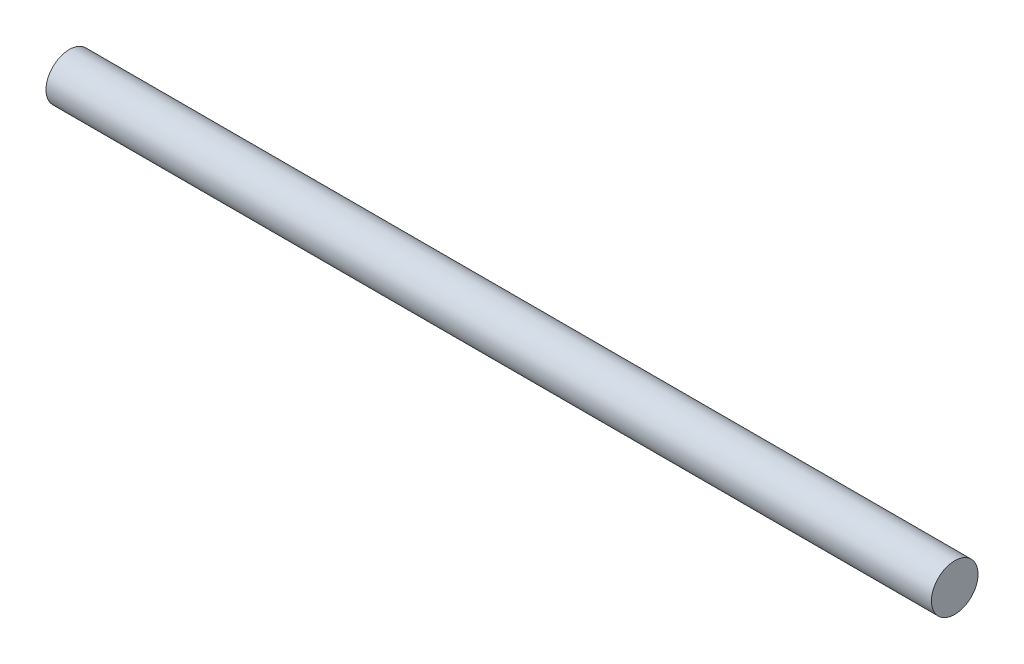
from build123d import *

# Parameters (mm, degrees)
SKETCH1_R           = 2.54
BOSS_EXTRUDE1_DEPTH = 96.52


with BuildPart() as part:
    # Sketch1 → Boss-Extrude1 (new body)
    with BuildSketch(Plane(origin=(0, 0, 0), x_dir=(0, 0, -1), z_dir=(1, 0, 0))):
        Circle(SKETCH1_R)
    extrude(amount=BOSS_EXTRUDE1_DEPTH)


solid = part.part
